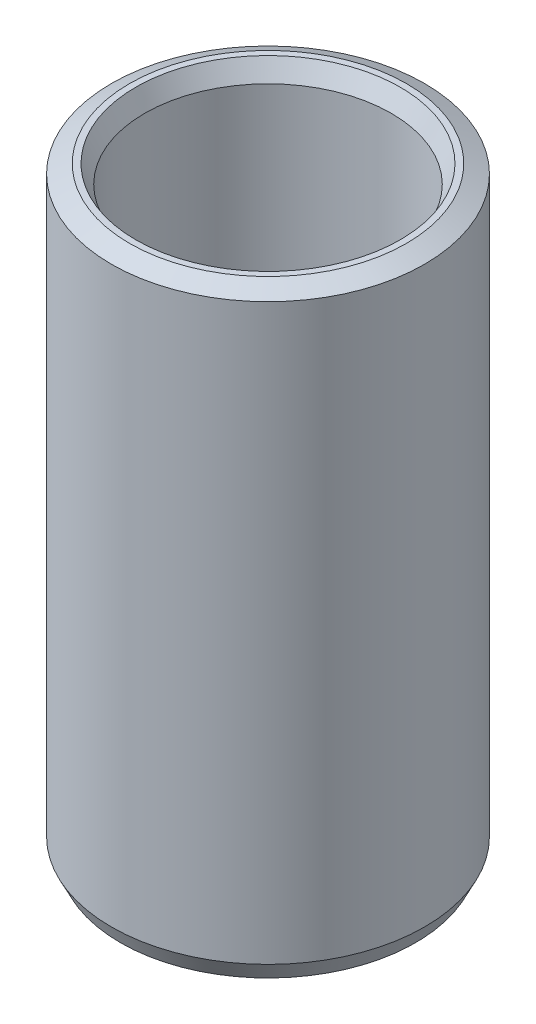
from build123d import *
from OCP.BRepFilletAPI import BRepFilletAPI_MakeChamfer

# Parameters (mm, degrees)
SKETCH1_R           = 57.5
BOSS_EXTRUDE1_DEPTH = 220.703764284
SKETCH2_R           = 45.261364468
CUT_EXTRUDE1_DEPTH  = 236.20767753
CHAMFER1_SIZE       = 3.296480806
CHAMFER1_SIZE2      = 6.657233645


with BuildPart() as part:
    # Sketch1 → Boss-Extrude1 (new body)
    with BuildSketch(Plane(origin=(0, 0, 0), x_dir=(1, 0, 0), z_dir=(0, 1, 0))):
        Circle(SKETCH1_R)
    extrude(amount=BOSS_EXTRUDE1_DEPTH)

    # Sketch2 → Cut-Extrude1 (cut, through all)
    with BuildSketch(Plane(origin=(0, 0, 0), x_dir=(1, 0, 0), z_dir=(0, 1, 0))):
        Circle(SKETCH2_R)
    extrude(amount=CUT_EXTRUDE1_DEPTH, mode=Mode.SUBTRACT)

    # Chamfer1: one chamfer whose edges measure the first distance from different faces: ONE call of the kernel's chamfer builder (chamfer() names one face for all edges)
    chamfer1_edges_1 = [part.edges().sort_by_distance(p)[0] for p in [
        (-45.261364468, 220.703764284, 0),
    ]]
    chamfer1_side_1 = [part.faces().sort_by_distance(p)[0] for p in [
        (-55.873654403, 220.703764284, 0),
    ]]
    chamfer1_edges_2 = [part.edges().sort_by_distance(p)[0] for p in [
        (-45.261364468, 0, 0),
    ]]
    chamfer1_side_2 = [part.faces().sort_by_distance(p)[0] for p in [
        (-45.261364468, 110.351882142, 0),
    ]]
    chamfer1_edges_3 = [part.edges().sort_by_distance(p)[0] for p in [
        (-57.5, 0, 0),
    ]]
    chamfer1_side_3 = [part.faces().sort_by_distance(p)[0] for p in [
        (-55.873654403, 0, 0),
    ]]
    chamfer1_edges_4 = [part.edges().sort_by_distance(p)[0] for p in [
        (-57.5, 220.703764284, 0),
    ]]
    chamfer1_side_4 = [part.faces().sort_by_distance(p)[0] for p in [
        (-57.5, 110.351882142, 0),
    ]]
    chamfer1 = BRepFilletAPI_MakeChamfer(part.part.solid().wrapped)
    for e in chamfer1_edges_1:
        chamfer1.Add(CHAMFER1_SIZE, CHAMFER1_SIZE2, e.wrapped, chamfer1_side_1[0].wrapped)  # the first distance lies on this face
    for e in chamfer1_edges_2:
        chamfer1.Add(CHAMFER1_SIZE, CHAMFER1_SIZE2, e.wrapped, chamfer1_side_2[0].wrapped)  # the first distance lies on this face
    for e in chamfer1_edges_3:
        chamfer1.Add(CHAMFER1_SIZE, CHAMFER1_SIZE2, e.wrapped, chamfer1_side_3[0].wrapped)  # the first distance lies on this face
    for e in chamfer1_edges_4:
        chamfer1.Add(CHAMFER1_SIZE, CHAMFER1_SIZE2, e.wrapped, chamfer1_side_4[0].wrapped)  # the first distance lies on this face
    add(Compound.cast(chamfer1.Shape()), mode=Mode.REPLACE)


solid = part.part
